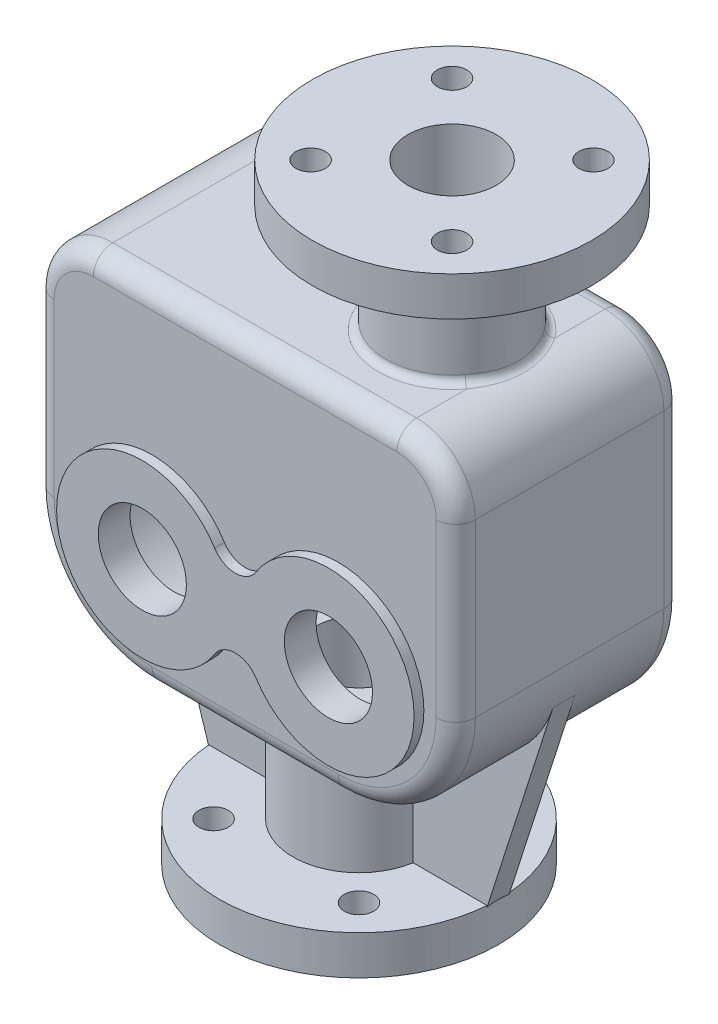
from build123d import *

# Parameters (mm, degrees)
EXTRUDE_1_DEPTH      = 46.5
FILLET_1_R           = 8
SHELL_1_T            = 9
FILLET_2_R           = 3
EXTRUDE_2_DEPTH      = 4
CUT_EXTRUDE_1_REACH  = 194.273
SKETCH_3_R           = 18
CUT_EXTRUDE_2_REACH  = 194.273
SKETCH_4_R           = 27.5
CUT_EXTRUDE_3_REACH  = 291.997
SKETCH_7_R           = 18
CUT_EXTRUDE_4_REACH  = 291.997
SKETCH_8_R           = 18
CUT_EXTRUDE_5_REACH  = 291.997
SKETCH_9_R           = 6
CUT_EXTRUDE_11_REACH = 291.997
SKETCH_17_R          = 6
RIB_1_REACH          = 232.387
SKETCH_18_WALL_W     = 550.300401762
SKETCH_18_WALL_H     = 9
FILLET_7_R           = 3


with BuildPart() as part:
    # 草圖1 → 伸長1 (new, symmetric)
    with BuildSketch(Plane.XY):
        with BuildLine():
            Line((-38, 0), (38, 0))
            ThreePointArc((38, 0), (71.941125497, 14.058874503), (86, 48))
            Line((86, 48), (86, 118))
            ThreePointArc((86, 118), (78.970562748, 134.970562748), (62, 142))
            Line((62, 142), (-62, 142))
            ThreePointArc((-62, 142), (-78.970562748, 134.970562748), (-86, 118))
            Line((-86, 118), (-86, 48))
            ThreePointArc((-86, 48), (-71.941125497, 14.058874503), (-38, 0))
        make_face()
    extrude(amount=EXTRUDE_1_DEPTH, both=True)

    # 圓角1
    fillet_1_edges = [part.edges().sort_by_distance(p)[0] for p in [
        (78.970562748, 134.970562748, 46.5),
        (86, 83, 46.5),
        (71.941125497, 14.058874503, 46.5),
        (0, 0, 46.5),
        (-71.941125497, 14.058874503, 46.5),
        (-86, 83, 46.5),
        (-78.970562748, 134.970562748, 46.5),
        (78.970562748, 134.970562748, -46.5),
        (86, 83, -46.5),
        (71.941125497, 14.058874503, -46.5),
        (0, 0, -46.5),
        (-71.941125497, 14.058874503, -46.5),
        (-86, 83, -46.5),
        (-78.970562748, 134.970562748, -46.5),
        (0, 142, 46.5),
        (0, 142, -46.5),
    ]]
    fillet(fillet_1_edges, radius=FILLET_1_R)

    # 薄殼1 (no face opened: a closed hollow body)
    add(offset(amount=-SHELL_1_T, mode=Mode.PRIVATE), mode=Mode.SUBTRACT)

    # 圓角2
    fillet_2_edges = [part.edges().sort_by_distance(p)[0] for p in [
        (0, 9, 37.5),
        (65.577164466, 20.422835534, 37.5),
        (77, 83, 37.5),
        (72.606601718, 128.606601718, 37.5),
        (0, 133, 37.5),
        (-72.606601718, 128.606601718, 37.5),
        (-77, 83, 37.5),
        (0, 9, -37.5),
        (65.577164466, 20.422835534, -37.5),
        (77, 83, -37.5),
        (72.606601718, 128.606601718, -37.5),
        (0, 133, -37.5),
        (-72.606601718, 128.606601718, -37.5),
        (-77, 83, -37.5),
        (-65.577164466, 20.422835534, 37.5),
        (-65.577164466, 20.422835534, -37.5),
    ]]
    fillet(fillet_2_edges, radius=FILLET_2_R)

    # 草圖2 → 伸長2 (add)
    with BuildSketch(Plane.XY.offset(46.5)):
        with BuildLine():
            ThreePointArc((8.444444444, 29.252489877), (73, 48), (8.444444444, 66.747510123))
            ThreePointArc((8.444444444, 66.747510123), (0, 62.103941586), (-8.444444444, 66.747510123))
            ThreePointArc((-8.444444444, 66.747510123), (-73, 48), (-8.444444444, 29.252489877))
            ThreePointArc((-8.444444444, 29.252489877), (0, 33.896058414), (8.444444444, 29.252489877))
        make_face()
    extrude(amount=EXTRUDE_2_DEPTH)

    # 草圖3 → 除料-伸長1 (cut, up to next)
    with BuildSketch(Plane.XY.offset(50.5), mode=Mode.PRIVATE) as cut_extrude_1_sk1:
        with Locations((38, 48)):
            Circle(SKETCH_3_R)
    cut_extrude_1_tool1 = extrude(cut_extrude_1_sk1.sketch, amount=-CUT_EXTRUDE_1_REACH, mode=Mode.PRIVATE) & part.part
    # 草圖3 → 除料-伸長1 (cut, up to next)
    with BuildSketch(Plane.XY.offset(50.5), mode=Mode.PRIVATE) as cut_extrude_1_sk2:
        with Locations((-38, 48)):
            Circle(SKETCH_3_R)
    cut_extrude_1_tool2 = extrude(cut_extrude_1_sk2.sketch, amount=-CUT_EXTRUDE_1_REACH, mode=Mode.PRIVATE) & part.part
    add(cut_extrude_1_tool1.solids().sort_by_distance((38, 48, 50.5))[0], mode=Mode.SUBTRACT)
    add(cut_extrude_1_tool2.solids().sort_by_distance((-38, 48, 50.5))[0], mode=Mode.SUBTRACT)

    # 草圖4 → 除料-伸長2 (cut, up to next)
    with BuildSketch(Plane(origin=(0, 0, -46.5), x_dir=(-1, 0, 0), z_dir=(0, 0, -1)), mode=Mode.PRIVATE) as cut_extrude_2_sk1:
        with Locations((-38, 48)):
            Circle(SKETCH_4_R)
    cut_extrude_2_tool1 = extrude(cut_extrude_2_sk1.sketch, amount=-CUT_EXTRUDE_2_REACH, mode=Mode.PRIVATE) & part.part
    # 草圖4 → 除料-伸長2 (cut, up to next)
    with BuildSketch(Plane(origin=(0, 0, -46.5), x_dir=(-1, 0, 0), z_dir=(0, 0, -1)), mode=Mode.PRIVATE) as cut_extrude_2_sk2:
        with Locations((38, 48)):
            Circle(SKETCH_4_R)
    cut_extrude_2_tool2 = extrude(cut_extrude_2_sk2.sketch, amount=-CUT_EXTRUDE_2_REACH, mode=Mode.PRIVATE) & part.part
    add(cut_extrude_2_tool1.solids().sort_by_distance((38, 48, -46.5))[0], mode=Mode.SUBTRACT)
    add(cut_extrude_2_tool2.solids().sort_by_distance((-38, 48, -46.5))[0], mode=Mode.SUBTRACT)

    # 草圖5 → 旋轉1 (revolve)
    with BuildSketch(Plane.XY):
        Polygon((0, -66), (57, -66), (57, -50), (27, -50), (27, 0), (0, 0), align=None)
    revolve(axis=Axis((0, 0, 0), (0, -1, 0)))

    # 草圖6 → 旋轉2 (revolve)
    with BuildSketch(Plane.XY):
        Polygon((11, 133), (11, 186), (-19, 186), (-19, 202), (38, 202), (38, 133), align=None)
    revolve(axis=Axis((38, 124.753510303, 0), (0, 1, 0)))

    # 草圖7 → 除料-伸長3 (cut, up to next)
    with BuildSketch(Plane.XZ.offset(66), mode=Mode.PRIVATE) as cut_extrude_3_sk1:
        Circle(SKETCH_7_R)
    cut_extrude_3_tool1 = extrude(cut_extrude_3_sk1.sketch, amount=-CUT_EXTRUDE_3_REACH, mode=Mode.PRIVATE) & part.part
    add(cut_extrude_3_tool1.solids().sort_by_distance((0, -66, 0))[0], mode=Mode.SUBTRACT)

    # 草圖8 → 除料-伸長4 (cut, up to next)
    with BuildSketch(Plane(origin=(0, 202, 0), x_dir=(-1, 0, 0), z_dir=(0, 1, 0)), mode=Mode.PRIVATE) as cut_extrude_4_sk1:
        with Locations((-38, 0)):
            Circle(SKETCH_8_R)
    cut_extrude_4_tool1 = extrude(cut_extrude_4_sk1.sketch, amount=-CUT_EXTRUDE_4_REACH, mode=Mode.PRIVATE) & part.part
    add(cut_extrude_4_tool1.solids().sort_by_distance((38, 202, 0))[0], mode=Mode.SUBTRACT)

    # 草圖9 → 除料-伸長5 (cut, up to next)
    with BuildSketch(Plane.XZ.offset(66), mode=Mode.PRIVATE) as cut_extrude_5_sk1:
        with Locations((29.69848481, 29.69848481)):
            Circle(SKETCH_9_R)
    cut_extrude_5_tool1 = extrude(cut_extrude_5_sk1.sketch, amount=-CUT_EXTRUDE_5_REACH, mode=Mode.PRIVATE) & part.part
    # 草圖9 → 除料-伸長5 (cut, up to next)
    with BuildSketch(Plane.XZ.offset(66), mode=Mode.PRIVATE) as cut_extrude_5_sk2:
        with Locations((-29.69848481, 29.69848481)):
            Circle(SKETCH_9_R)
    cut_extrude_5_tool2 = extrude(cut_extrude_5_sk2.sketch, amount=-CUT_EXTRUDE_5_REACH, mode=Mode.PRIVATE) & part.part
    # 草圖9 → 除料-伸長5 (cut, up to next)
    with BuildSketch(Plane.XZ.offset(66), mode=Mode.PRIVATE) as cut_extrude_5_sk3:
        with Locations((29.69848481, -29.69848481)):
            Circle(SKETCH_9_R)
    cut_extrude_5_tool3 = extrude(cut_extrude_5_sk3.sketch, amount=-CUT_EXTRUDE_5_REACH, mode=Mode.PRIVATE) & part.part
    # 草圖9 → 除料-伸長5 (cut, up to next)
    with BuildSketch(Plane.XZ.offset(66), mode=Mode.PRIVATE) as cut_extrude_5_sk4:
        with Locations((-29.69848481, -29.69848481)):
            Circle(SKETCH_9_R)
    cut_extrude_5_tool4 = extrude(cut_extrude_5_sk4.sketch, amount=-CUT_EXTRUDE_5_REACH, mode=Mode.PRIVATE) & part.part
    add(cut_extrude_5_tool1.solids().sort_by_distance((29.698485, -66, 29.698485))[0], mode=Mode.SUBTRACT)
    add(cut_extrude_5_tool2.solids().sort_by_distance((-29.698485, -66, 29.698485))[0], mode=Mode.SUBTRACT)
    add(cut_extrude_5_tool3.solids().sort_by_distance((29.698485, -66, -29.698485))[0], mode=Mode.SUBTRACT)
    add(cut_extrude_5_tool4.solids().sort_by_distance((-29.698485, -66, -29.698485))[0], mode=Mode.SUBTRACT)

    # 草圖17 → 除料-伸長11 (cut, up to next)
    with BuildSketch(Plane(origin=(0, 202, 0), x_dir=(1, 0, 0), z_dir=(0, 1, 0)), mode=Mode.PRIVATE) as cut_extrude_11_sk1:
        with Locations((66.878187984, 28.878187984)):
            Circle(SKETCH_17_R)
    cut_extrude_11_tool1 = extrude(cut_extrude_11_sk1.sketch, amount=-CUT_EXTRUDE_11_REACH, mode=Mode.PRIVATE) & part.part
    # 草圖17 → 除料-伸長11 (cut, up to next)
    with BuildSketch(Plane(origin=(0, 202, 0), x_dir=(1, 0, 0), z_dir=(0, 1, 0)), mode=Mode.PRIVATE) as cut_extrude_11_sk2:
        with Locations((9.121812016, 28.878187984)):
            Circle(SKETCH_17_R)
    cut_extrude_11_tool2 = extrude(cut_extrude_11_sk2.sketch, amount=-CUT_EXTRUDE_11_REACH, mode=Mode.PRIVATE) & part.part
    # 草圖17 → 除料-伸長11 (cut, up to next)
    with BuildSketch(Plane(origin=(0, 202, 0), x_dir=(1, 0, 0), z_dir=(0, 1, 0)), mode=Mode.PRIVATE) as cut_extrude_11_sk3:
        with Locations((66.878187984, -28.878187984)):
            Circle(SKETCH_17_R)
    cut_extrude_11_tool3 = extrude(cut_extrude_11_sk3.sketch, amount=-CUT_EXTRUDE_11_REACH, mode=Mode.PRIVATE) & part.part
    # 草圖17 → 除料-伸長11 (cut, up to next)
    with BuildSketch(Plane(origin=(0, 202, 0), x_dir=(1, 0, 0), z_dir=(0, 1, 0)), mode=Mode.PRIVATE) as cut_extrude_11_sk4:
        with Locations((9.121812016, -28.878187984)):
            Circle(SKETCH_17_R)
    cut_extrude_11_tool4 = extrude(cut_extrude_11_sk4.sketch, amount=-CUT_EXTRUDE_11_REACH, mode=Mode.PRIVATE) & part.part
    add(cut_extrude_11_tool1.solids().sort_by_distance((66.878188, 202, -28.878188))[0], mode=Mode.SUBTRACT)
    add(cut_extrude_11_tool2.solids().sort_by_distance((9.121812, 202, -28.878188))[0], mode=Mode.SUBTRACT)
    add(cut_extrude_11_tool3.solids().sort_by_distance((66.878188, 202, 28.878188))[0], mode=Mode.SUBTRACT)
    add(cut_extrude_11_tool4.solids().sort_by_distance((9.121812, 202, 28.878188))[0], mode=Mode.SUBTRACT)

    # 草圖18 wall → 肋材1 (add, up to next)
    with BuildSketch(Plane(origin=(70.355176126, -8.323996465, 0), x_dir=(0.305166519386, 0.952299005274, 0), z_dir=(-0.952299005274, 0.305166519386, 0)), mode=Mode.PRIVATE) as rib_1_sk1:
        Rectangle(SKETCH_18_WALL_W, SKETCH_18_WALL_H)
    rib_1_tool1 = extrude(rib_1_sk1.sketch, amount=RIB_1_REACH, mode=Mode.PRIVATE) - part.part
    rib_1 = rib_1_tool1.solids().sort_by_distance((70.355176126, -8.323996465, 0))[0]
    add(rib_1)

    # 圓角7
    fillet_7_edges = [part.edges().sort_by_distance(p)[0] for p in [
        (65, 141.8117618, 0),
        (31.636038969, 142, -26.239283527),
    ]]
    fillet(fillet_7_edges, radius=FILLET_7_R)

    # 鏡射1: 肋材1 across plane
    add(rib_1.mirror(Plane(origin=(0, 0, 0), x_dir=(0, 0, 1), z_dir=(1, 0, 0))))


solid = part.part
